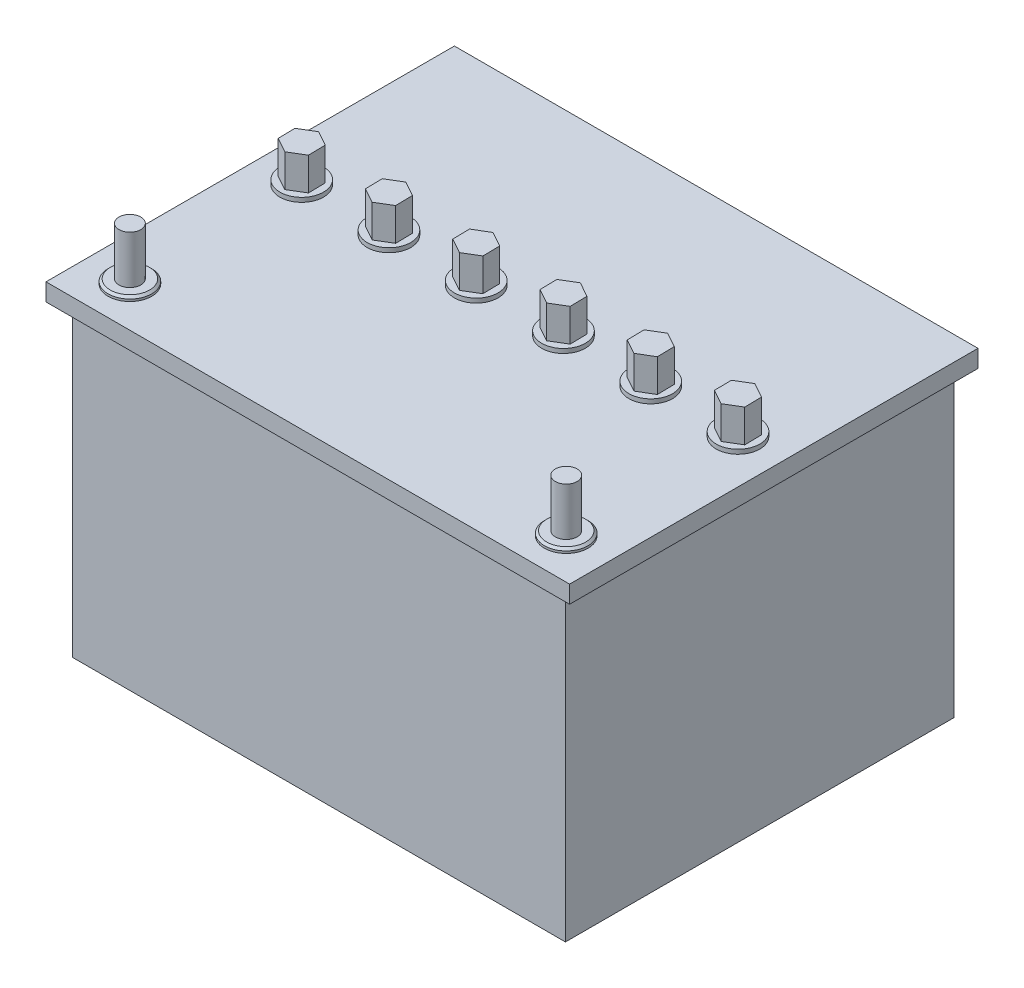
from build123d import *

# Parameters (mm, degrees)
SKETCH2_W           = 113
SKETCH2_H           = 70
BOSS_EXTRUDE2_DEPTH = 89
SKETCH3_W           = 120
SKETCH3_H           = 93.6
BOSS_EXTRUDE3_DEPTH = 4
SKETCH5_R           = 5
BOSS_EXTRUDE4_DEPTH = 1
BOSS_EXTRUDE5_DEPTH = 7.5
SKETCH9_R           = 5
BOSS_EXTRUDE6_DEPTH = 1
SKETCH11_R          = 2.5
BOSS_EXTRUDE7_DEPTH = 11


with BuildPart() as part:
    # Sketch2 → Boss-Extrude2 (new body)
    with BuildSketch(Plane.XY):
        with Locations((56.5, -35)):
            Rectangle(SKETCH2_W, SKETCH2_H)
    extrude(amount=BOSS_EXTRUDE2_DEPTH)

    # Sketch3 → Boss-Extrude3 (add)
    with BuildSketch(Plane(origin=(0, 0, 0), x_dir=(1, 0, 0), z_dir=(0, 1, 0))):
        with Locations((56.443629761, -44.692561868)):
            Rectangle(SKETCH3_W, SKETCH3_H)
    extrude(amount=BOSS_EXTRUDE3_DEPTH)

    # Sketch5 → Boss-Extrude4 (add)
    with BuildSketch(Plane(origin=(0, 4, 0), x_dir=(1, 0, 0), z_dir=(0, 1, 0))):
        with Locations(Location((6.443629761, -42.892561868, 0), (0, 0, 270))):
            Circle(SKETCH5_R)
        with Locations(Location((26.443629761, -42.892561868, 0), (0, 0, 270))):
            Circle(SKETCH5_R)
        with Locations(Location((46.443629761, -42.892561868, 0), (0, 0, 270))):
            Circle(SKETCH5_R)
        with Locations(Location((66.443629761, -42.892561868, 0), (0, 0, 270))):
            Circle(SKETCH5_R)
        with Locations(Location((86.443629761, -42.892561868, 0), (0, 0, 270))):
            Circle(SKETCH5_R)
        with Locations(Location((106.443629761, -42.892561868, 0), (0, 0, 270))):
            Circle(SKETCH5_R)
    extrude(amount=BOSS_EXTRUDE4_DEPTH)

    # Sketch7 → Boss-Extrude5 (add)
    with BuildSketch(Plane(origin=(0, 5, 0), x_dir=(1, 0, 0), z_dir=(0, 1, 0))):
        Polygon((29.878505301, -44.792186338), (29.80619058, -40.867684626), (26.37131504, -38.968060156), (23.008754221, -40.992937397), (23.081068941, -44.917439109), (26.515944482, -46.81706358), align=None)
        Polygon((9.878505301, -44.792186338), (9.80619058, -40.867684626), (6.37131504, -38.968060156), (3.008754221, -40.992937397), (3.081068941, -44.917439109), (6.515944482, -46.81706358), align=None)
        Polygon((49.878505301, -44.792186338), (49.80619058, -40.867684626), (46.37131504, -38.968060156), (43.008754221, -40.992937397), (43.081068941, -44.917439109), (46.515944482, -46.81706358), align=None)
        Polygon((69.878505301, -44.792186338), (69.80619058, -40.867684626), (66.37131504, -38.968060156), (63.008754221, -40.992937397), (63.081068941, -44.917439109), (66.515944482, -46.81706358), align=None)
        Polygon((89.878505301, -44.792186338), (89.80619058, -40.867684626), (86.37131504, -38.968060156), (83.008754221, -40.992937397), (83.081068941, -44.917439109), (86.515944482, -46.81706358), align=None)
        Polygon((109.878505301, -44.792186338), (109.80619058, -40.867684626), (106.37131504, -38.968060156), (103.008754221, -40.992937397), (103.081068941, -44.917439109), (106.515944482, -46.81706358), align=None)
    extrude(amount=BOSS_EXTRUDE5_DEPTH)

    # Sketch9 → Boss-Extrude6 (add)
    with BuildSketch(Plane(origin=(0, 4, 0), x_dir=(1, 0, 0), z_dir=(0, 1, 0))):
        with Locations(Location((6.443629761, -82.263237169, 0), (0, 0, 270))):
            Circle(SKETCH9_R)
        with Locations(Location((106.443629761, -82.263237169, 0), (0, 0, 270))):
            Circle(SKETCH9_R)
    extrude(amount=BOSS_EXTRUDE6_DEPTH)

    # Fillet5: read off the stored shape, not the designer's step
    # Fillet5 outline → Fillet5 (revolve, cut)
    with BuildSketch(Plane(origin=(6.443629761, 0, 82.263237169), x_dir=(1, 0, 0), z_dir=(0, 0, 1))):
        Polygon((5, 5), (4.5, 5), (5, 4.5), align=None)
    revolve(axis=Axis((6.443629761, 0, 82.263237169), (0, 1, 0)), mode=Mode.SUBTRACT)

    # Fillet7: read off the stored shape, not the designer's step
    # Fillet7 outline → Fillet7 (revolve, cut)
    with BuildSketch(Plane(origin=(106.443629761, 0, 82.263237169), x_dir=(1, 0, 0), z_dir=(0, 0, 1))):
        Polygon((5, 5), (4.5, 5), (5, 4.5), align=None)
    revolve(axis=Axis((106.443629761, 0, 82.263237169), (0, 1, 0)), mode=Mode.SUBTRACT)

    # Sketch11 → Boss-Extrude7 (add)
    with BuildSketch(Plane(origin=(0, 5, 0), x_dir=(1, 0, 0), z_dir=(0, 1, 0))):
        with Locations(Location((6.443629761, -82.263237169, 0), (0, 0, 270))):
            Circle(SKETCH11_R)
        with Locations(Location((106.443629761, -82.263237169, 0), (0, 0, 270))):
            Circle(SKETCH11_R)
    extrude(amount=BOSS_EXTRUDE7_DEPTH)


solid = part.part
